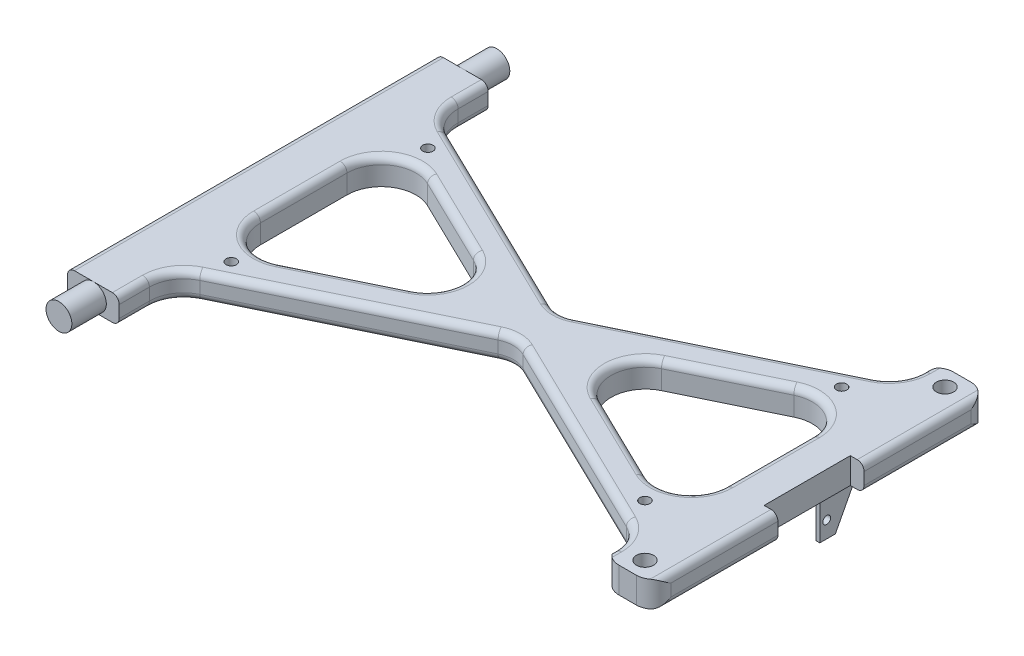
from build123d import *

# Parameters (mm, degrees)
SKETCH1_R           = 1.5
BOSS_EXTRUDE1_DEPTH = 7.5
FILLET1_R           = 2
SKETCH2_R           = 3.75
BOSS_EXTRUDE2_DEPTH = 10
BOSS_EXTRUDE3_START = 10
SKETCH3_R           = 3.75
BOSS_EXTRUDE3_DEPTH = 10
SKETCH4_R           = 2.5
CUT_EXTRUDE1_DEPTH  = 117.391907178
FILLET2_R           = 5
SKETCH5_W           = 4
SKETCH5_H           = 25
CUT_EXTRUDE2_DEPTH  = 117.391907257
BOSS_EXTRUDE4_DEPTH = 20
SKETCH6_3_W         = 2
SKETCH6_3_H         = 7.5
BOSS_EXTRUDE5_DEPTH = 8.5
CUT_EXTRUDE3_START  = 1
SKETCH8_R           = 1.13
CUT_EXTRUDE3_DEPTH  = 4


# Read off the part's stored shape, not the designer's step: Boss-Extrude4
with BuildPart() as part:
    # Sketch1 → Boss-Extrude1 (new body)
    with BuildSketch(Plane(origin=(0, 0, 0), x_dir=(1, 0, 0), z_dir=(0, 1, 0))):
        with BuildLine():
            Line((-80.136044352, 69.302806308), (-80.136044352, -37.737193692))
            Line((-80.136044352, -37.737193692), (-65.136044352, -37.737193692))
            Line((-65.136044352, -37.737193692), (-65.136044352, -28.997899093))
            ThreePointArc((-65.136044352, -28.997899093), (-63.611946772, -23.691386287), (-59.504228719, -20.002402146))
            Line((-59.504228719, -20.002402146), (-1.255884574, 8.282806308))
            ThreePointArc((-1.255884574, 8.282806308), (2.363955648, 9.115220933), (5.983795869, 8.282806308))
            Line((5.983795869, 8.282806308), (64.232140015, -20.002402146))
            ThreePointArc((64.232140015, -20.002402146), (68.339858068, -23.691386287), (69.863955648, -28.997899093))
            Line((69.863955648, -28.997899093), (69.863955648, -32.737193692))
            Line((69.863955648, -32.737193692), (84.863955648, -32.737193692))
            Line((84.863955648, -32.737193692), (84.863955648, 64.302806308))
            Line((84.863955648, 64.302806308), (69.863955648, 64.302806308))
            Line((69.863955648, 64.302806308), (69.863955648, 60.563511709))
            ThreePointArc((69.863955648, 60.563511709), (68.339858068, 55.256998903), (64.232140015, 51.568014762))
            Line((64.232140015, 51.568014762), (5.983795869, 23.282806308))
            ThreePointArc((5.983795869, 23.282806308), (2.363955648, 22.450391683), (-1.255884574, 23.282806308))
            Line((-1.255884574, 23.282806308), (-59.504228719, 51.568014762))
            ThreePointArc((-59.504228719, 51.568014762), (-63.611946772, 55.256998903), (-65.136044352, 60.563511709))
            Line((-65.136044352, 60.563511709), (-65.136044352, 69.302806308))
            Line((-65.136044352, 69.302806308), (-80.136044352, 69.302806308))
        make_face()
        with Locations(Location((-57.636044352, -12.737193692, 0), (0, 0, 270))):
            Circle(SKETCH1_R, mode=Mode.SUBTRACT)
        with Locations(Location((62.363955648, -12.737193692, 0), (0, 0, 270))):
            Circle(SKETCH1_R, mode=Mode.SUBTRACT)
        with Locations(Location((62.363955648, 44.302806308, 0), (0, 0, 270))):
            Circle(SKETCH1_R, mode=Mode.SUBTRACT)
        with Locations(Location((-57.636044352, 44.302806308, 0), (0, 0, 270))):
            Circle(SKETCH1_R, mode=Mode.SUBTRACT)
        with BuildLine():
            Line((-50.767859985, 37.325662221), (-24.928811129, 24.778303256))
            ThreePointArc((-24.928811129, 24.778303256), (-19.296995496, 15.782806308), (-24.928811129, 6.78730936))
            Line((-24.928811129, 6.78730936), (-50.767859985, -5.760049605))
            ThreePointArc((-50.767859985, -5.760049605), (-60.442557159, -5.240455078), (-65.136044352, 3.235447342))
            Line((-65.136044352, 3.235447342), (-65.136044352, 28.330165273))
            ThreePointArc((-65.136044352, 28.330165273), (-60.442557159, 36.806067694), (-50.767859985, 37.325662221))
        make_face(mode=Mode.SUBTRACT)
        with BuildLine():
            Line((29.656722425, 24.778303256), (55.495771281, 37.325662221))
            ThreePointArc((55.495771281, 37.325662221), (65.170468454, 36.806067694), (69.863955648, 28.330165273))
            Line((69.863955648, 28.330165273), (69.863955648, 3.235447342))
            ThreePointArc((69.863955648, 3.235447342), (65.170468454, -5.240455078), (55.495771281, -5.760049605))
            Line((55.495771281, -5.760049605), (29.656722425, 6.78730936))
            ThreePointArc((29.656722425, 6.78730936), (24.024906792, 15.782806308), (29.656722425, 24.778303256))
        make_face(mode=Mode.SUBTRACT)
    extrude(amount=BOSS_EXTRUDE1_DEPTH)

    # Fillet1
    fillet1_edges = [part.edges().sort_by_distance(p)[0] for p in [
        (-65.136044352, 7.5, 33.367546393),
        (-63.611946772, 7.5, 23.691386287),
        (-65.136044352, 0, -64.933159009),
        (-63.611946772, 0, -55.256998903),
        (-30.380056647, 0, -37.425410535),
        (2.363955648, 0, -22.450391683),
        (35.107967942, 0, -37.425410535),
        (-30.380056647, 7.5, 5.859797919),
        (68.339858068, 0, -55.256998903),
        (69.863955648, 0, -62.433159009),
        (84.863955648, 0, -15.782806308),
        (69.863955648, 0, 30.867546393),
        (68.339858068, 0, 23.691386287),
        (2.363955648, 7.5, -9.115220933),
        (35.107967942, 0, 5.859797919),
        (2.363955648, 0, -9.115220933),
        (-30.380056647, 0, 5.859797919),
        (-63.611946772, 0, 23.691386287),
        (-65.136044352, 0, 33.367546393),
        (-80.136044352, 0, -15.782806308),
        (35.107967942, 7.5, 5.859797919),
        (68.339858068, 7.5, 23.691386287),
        (69.863955648, 7.5, 30.867546393),
        (84.863955648, 7.5, -15.782806308),
        (69.863955648, 7.5, -62.433159009),
        (68.339858068, 7.5, -55.256998903),
        (35.107967942, 7.5, -37.425410535),
        (2.363955648, 7.5, -22.450391683),
        (-30.380056647, 7.5, -37.425410535),
        (-63.611946772, 7.5, -55.256998903),
        (-65.136044352, 7.5, -64.933159009),
        (-60.442557159, 7.5, 5.240455078),
        (-37.848335557, 7.5, -0.513629878),
        (-19.296995496, 7.5, -15.782806308),
        (-80.136044352, 7.5, -15.782806308),
        (-37.848335557, 7.5, -31.051982738),
        (-60.442557159, 7.5, -36.806067694),
        (-65.136044352, 7.5, -15.782806308),
        (65.170468454, 7.5, -36.806067694),
        (42.576246853, 7.5, -31.051982738),
        (24.024906792, 7.5, -15.782806308),
        (42.576246853, 7.5, -0.513629878),
        (65.170468454, 7.5, 5.240455078),
        (69.863955648, 7.5, -15.782806308),
    ]]
    fillet(fillet1_edges, radius=FILLET1_R)

    # Sketch2 → Boss-Extrude2 (add)
    with BuildSketch(Plane.XY.offset(37.737193692)):
        with Locations(Location((-72.636044352, 3.75, 0), (0, 0, 270))):
            Circle(SKETCH2_R)
    extrude(amount=BOSS_EXTRUDE2_DEPTH)

    # Sketch3 → Boss-Extrude3 (add)
    with BuildSketch(Plane(origin=(0, 0, -69.302806308), x_dir=(-1, 0, 0), z_dir=(0, 0, -1)).offset(BOSS_EXTRUDE3_START)):
        with Locations(Location((72.636044352, 3.75, 0), (0, 0, 270))):
            Circle(SKETCH3_R)
    extrude(amount=-BOSS_EXTRUDE3_DEPTH)

    # Sketch4 → Cut-Extrude1 (cut, through all)
    with BuildSketch(Plane(origin=(0, 7.5, 0), x_dir=(1, 0, 0), z_dir=(0, 1, 0))):
        with Locations(Location((77.363955648, 59.302806308, 0), (0, 0, 270))):
            Circle(SKETCH4_R)
        with Locations(Location((77.363955648, -27.737193692, 0), (0, 0, 270))):
            Circle(SKETCH4_R)
    extrude(amount=-CUT_EXTRUDE1_DEPTH, mode=Mode.SUBTRACT)

    # Fillet2
    # the kernel refuses this fillet: 5 mm, written as the material it takes off along each edge
    with BuildSketch(Plane(origin=(69.863955648, -10.367317094, 32.737193692), x_dir=(1, 0, 0), z_dir=(0, 1, 0))) as fillet2_piece_1:
        with BuildLine():
            CenterArc((4.946926838, 5), FILLET2_R, 184.821227429, 85.178772571)
            Line((-0.035382108, 4.579764866), (-0.533613003, 4.537741353))
            ThreePointArc((-0.533613003, 4.537741353), (-0.5, 3.739294599), (-0.5, 0))
            Line((-0.5, 0), (0, -0.5))
            Line((0, -0.5), (4.946926838, -0.5))
            Line((4.946926838, -0.5), (4.946926838, 0))
        make_face()
    extrude(amount=28.234634188, mode=Mode.SUBTRACT)
    with BuildSketch(Plane(origin=(84.863955648, -10.5, 32.737193692), x_dir=(-1, 0, 0), z_dir=(0, 1, 0))) as fillet2_piece_2:
        with BuildLine():
            CenterArc((FILLET2_R, -FILLET2_R), FILLET2_R, 90, 90)
            Line((0, -FILLET2_R), (0, 0))
            Line((0, 0), (FILLET2_R, 0))
        make_face()
    extrude(amount=28.5, mode=Mode.SUBTRACT)
    with BuildSketch(Plane(origin=(69.863955648, -10.367317094, -64.302806308), x_dir=(1, 0, 0), z_dir=(0, 1, 0))) as fillet2_piece_3:
        with BuildLine():
            CenterArc((4.946926838, -5), FILLET2_R, 90, 85.178772571)
            Line((-0.035382108, -4.579764866), (-0.533613003, -4.537741353))
            ThreePointArc((-0.533613003, -4.537741353), (-0.5, -3.739294599), (-0.5, 0))
            Line((-0.5, 0), (0, 0.5))
            Line((0, 0.5), (4.946926838, 0.5))
            Line((4.946926838, 0.5), (4.946926838, 0))
        make_face()
    extrude(amount=28.234634188, mode=Mode.SUBTRACT)
    with BuildSketch(Plane(origin=(84.863955648, -10.5, -64.302806308), x_dir=(-1, 0, 0), z_dir=(0, 1, 0))) as fillet2_piece_4:
        with BuildLine():
            CenterArc((FILLET2_R, FILLET2_R), FILLET2_R, 180, 90)
            Line((0, FILLET2_R), (0, 0))
            Line((0, 0), (FILLET2_R, 0))
        make_face()
    extrude(amount=28.5, mode=Mode.SUBTRACT)

    # Sketch5 → Cut-Extrude2 (cut, through all)
    with BuildSketch(Plane(origin=(0, 7.5, 0), x_dir=(1, 0, 0), z_dir=(0, 1, 0))):
        with Locations((82.863955648, 15.830165273)):
            Rectangle(SKETCH5_W, SKETCH5_H)
    extrude(amount=-CUT_EXTRUDE2_DEPTH, mode=Mode.SUBTRACT)

    # Boss-Extrude4 outline → Boss-Extrude4 (add)
    with BuildSketch(Plane.XZ):
        with BuildLine():
            ThreePointArc((69.795627763, -29.497165273), (69.463388287, -31.13210978), (68.863955648, -32.689064217))
            Line((68.863955648, -32.689064217), (68.863955648, -44.497165273))
            Line((68.863955648, -44.497165273), (70.863955648, -44.497165273))
            Line((70.863955648, -44.497165273), (70.863955648, -29.497165273))
            Line((70.863955648, -29.497165273), (69.795627763, -29.497165273))
        make_face()
    extrude(amount=BOSS_EXTRUDE4_DEPTH)

    # Sketch6<3> → Boss-Extrude5 (add)
    with BuildSketch(Plane.XZ):
        with Locations((69.863955648, 15.252834727)):
            Rectangle(SKETCH6_3_W, SKETCH6_3_H)
    extrude(amount=BOSS_EXTRUDE5_DEPTH)

    # Sketch8 → Cut-Extrude3 (cut)
    with BuildSketch(Plane(origin=(70.863955648, 0, 0), x_dir=(0, 0, -1), z_dir=(1, 0, 0)).offset(CUT_EXTRUDE3_START)):
        with Locations((-13.502834727, -5.08)):
            Circle(SKETCH8_R)
        with Locations((31.497165273, -15.24)):
            Circle(SKETCH8_R)
        Polygon((-14.502834727, -8.5), (-19.002834727, -8.5), (-19.002834727, 0), align=None)
        Polygon((33.997165273, -20), (44.497165273, -20), (44.497165273, 0), align=None)
    extrude(amount=-CUT_EXTRUDE3_DEPTH, mode=Mode.SUBTRACT)


solid = part.part
